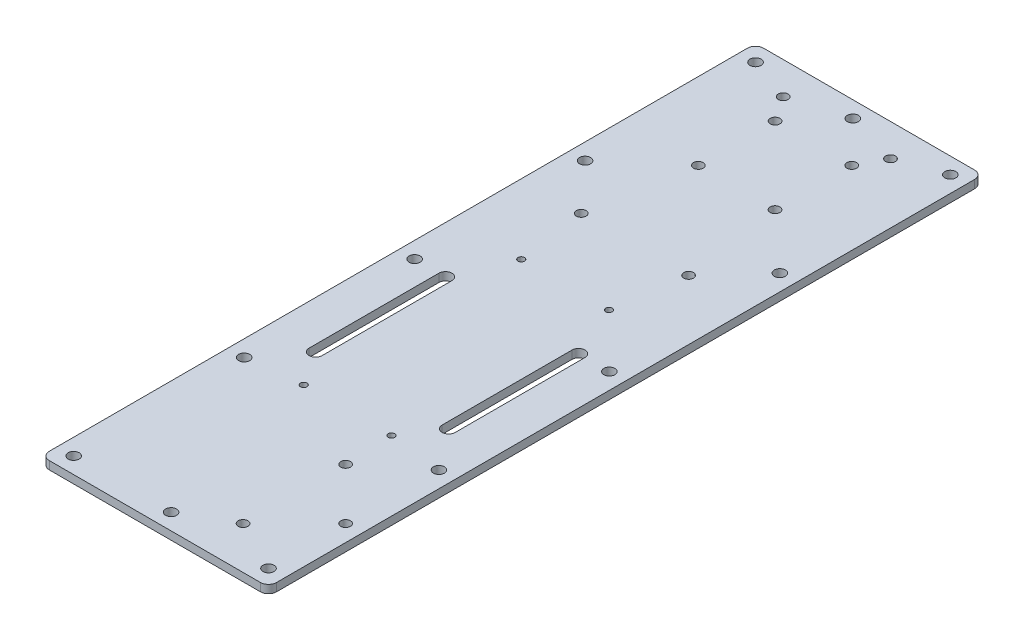
from build123d import *

# Parameters (mm, degrees)
PLATE_THICKNESS_DEPTH      = 3.175
SKETCH3_R                  = 2.159
MOUNTING_HOLES_DEPTH       = 147.635511132
SKETCH4_R                  = 1.905
JETSON_HOLES_W_MOUNT_DEPTH = 147.635511132
SKETCH5_R                  = 1.905
PDB_HOLES_DEPTH            = 147.635511132
SKETCH6_R                  = 1.905
LIDAR_HOLES_DEPTH          = 147.635511132
SKETCH7_R                  = 1.27
PIXHAWK_HOLES_DEPTH        = 147.635511132
BATTERY_HOLES_DEPTH        = 147.635511132


with BuildPart() as part:
    # Sketch2 → Plate Thickness (new body)
    with BuildSketch(Plane(origin=(0, 0, 0), x_dir=(1, 0, 0), z_dir=(0, 1, 0))):
        with BuildLine():
            Line((-41.275, 139.7), (41.275, 139.7))
            ThreePointArc((41.275, 139.7), (43.52006403, 138.77006403), (44.45, 136.525))
            Line((44.45, 136.525), (44.45, -136.525))
            ThreePointArc((44.45, -136.525), (43.52006403, -138.77006403), (41.275, -139.7))
            Line((41.275, -139.7), (-41.275, -139.7))
            ThreePointArc((-41.275, -139.7), (-43.52006403, -138.77006403), (-44.45, -136.525))
            Line((-44.45, -136.525), (-44.45, 136.525))
            ThreePointArc((-44.45, 136.525), (-43.52006403, 138.77006403), (-41.275, 139.7))
        make_face()
    extrude(amount=PLATE_THICKNESS_DEPTH)

    # Sketch3 → Mounting holes (cut, through all)
    with BuildSketch(Plane(origin=(0, 3.175, 0), x_dir=(1, 0, 0), z_dir=(0, 1, 0))):
        with Locations((-38.1, 133.35)):
            Circle(SKETCH3_R)
        with Locations((-38.1, 66.675)):
            Circle(SKETCH3_R)
        with Locations((-38.1, -66.675)):
            Circle(SKETCH3_R)
        with Locations((-38.1, -133.35)):
            Circle(SKETCH3_R)
        with Locations((38.1, -133.35)):
            Circle(SKETCH3_R)
        with Locations((38.1, -66.675)):
            Circle(SKETCH3_R)
        with Locations((38.1, 66.675)):
            Circle(SKETCH3_R)
        with Locations((38.1, 133.35)):
            Circle(SKETCH3_R)
        with Locations((0, 133.35)):
            Circle(SKETCH3_R)
        with Locations((0, -133.35)):
            Circle(SKETCH3_R)
        with Locations((-38.1, 0)):
            Circle(SKETCH3_R)
        with Locations((38.1, 0)):
            Circle(SKETCH3_R)
    extrude(amount=-MOUNTING_HOLES_DEPTH, mode=Mode.SUBTRACT)

    # Sketch4 → Jetson Holes (w/ mount) (cut, through all)
    with BuildSketch(Plane(origin=(0, 3.175, 0), x_dir=(1, 0, 0), z_dir=(0, 1, 0))):
        with Locations((-21.0058, 127.075242309)):
            Circle(SKETCH4_R)
        with Locations((-21.0058, 48.081242309)):
            Circle(SKETCH4_R)
        with Locations((21.0058, 48.081242309)):
            Circle(SKETCH4_R)
        with Locations((21.0058, 127.075242309)):
            Circle(SKETCH4_R)
    extrude(amount=-JETSON_HOLES_W_MOUNT_DEPTH, mode=Mode.SUBTRACT)

    # Sketch5 → PDB holes (cut, through all)
    with BuildSketch(Plane(origin=(0, 3.175, 0), x_dir=(1, 0, 0), z_dir=(0, 1, 0))):
        with Locations((-14.341868752, 117.235149692)):
            Circle(SKETCH5_R)
        with Locations((15.655531248, 117.235149692)):
            Circle(SKETCH5_R)
        with Locations((15.655531248, 87.237749692)):
            Circle(SKETCH5_R)
        with Locations((-14.341868752, 87.237749692)):
            Circle(SKETCH5_R)
    extrude(amount=-PDB_HOLES_DEPTH, mode=Mode.SUBTRACT)

    # Sketch6 → Lidar Holes (cut, through all)
    with BuildSketch(Plane(origin=(0, 3.175, 0), x_dir=(1, 0, 0), z_dir=(0, 1, 0))):
        with Locations((38.003189405, -103.082806339)):
            Circle(SKETCH6_R)
        with Locations((17.937189405, -83.016806339)):
            Circle(SKETCH6_R)
        with Locations((17.937189405, -123.148806339)):
            Circle(SKETCH6_R)
    extrude(amount=-LIDAR_HOLES_DEPTH, mode=Mode.SUBTRACT)

    # Sketch7 → PixHawk Holes (cut, through all)
    with BuildSketch(Plane(origin=(0, 3.175, 0), x_dir=(1, 0, 0), z_dir=(0, 1, 0))):
        with Locations((-17.145, 20.769931445)):
            Circle(SKETCH7_R)
        with Locations((-17.145, -64.320068555)):
            Circle(SKETCH7_R)
        with Locations((17.145, -64.320068555)):
            Circle(SKETCH7_R)
        with Locations((17.145, 20.769931445)):
            Circle(SKETCH7_R)
    extrude(amount=-PIXHAWK_HOLES_DEPTH, mode=Mode.SUBTRACT)

    # Sketch8 → Battery Holes (cut, through all)
    with BuildSketch(Plane(origin=(0, 3.175, 0), x_dir=(1, 0, 0), z_dir=(0, 1, 0))):
        with BuildLine():
            Line((-23.495, -0.005964701), (-23.495, -50.805964701))
            ThreePointArc((-23.495, -50.805964701), (-26.035, -53.345964701), (-28.575, -50.805964701))
            Line((-28.575, -50.805964701), (-28.575, -0.005964701))
            ThreePointArc((-28.575, -0.005964701), (-26.035, 2.534035299), (-23.495, -0.005964701))
        make_face()
        with BuildLine():
            Line((23.495, -0.005964701), (23.495, -50.805964701))
            ThreePointArc((23.495, -50.805964701), (26.035, -53.345964701), (28.575, -50.805964701))
            Line((28.575, -50.805964701), (28.575, -0.005964701))
            ThreePointArc((28.575, -0.005964701), (26.035, 2.534035299), (23.495, -0.005964701))
        make_face()
    extrude(amount=-BATTERY_HOLES_DEPTH, mode=Mode.SUBTRACT)


solid = part.part
